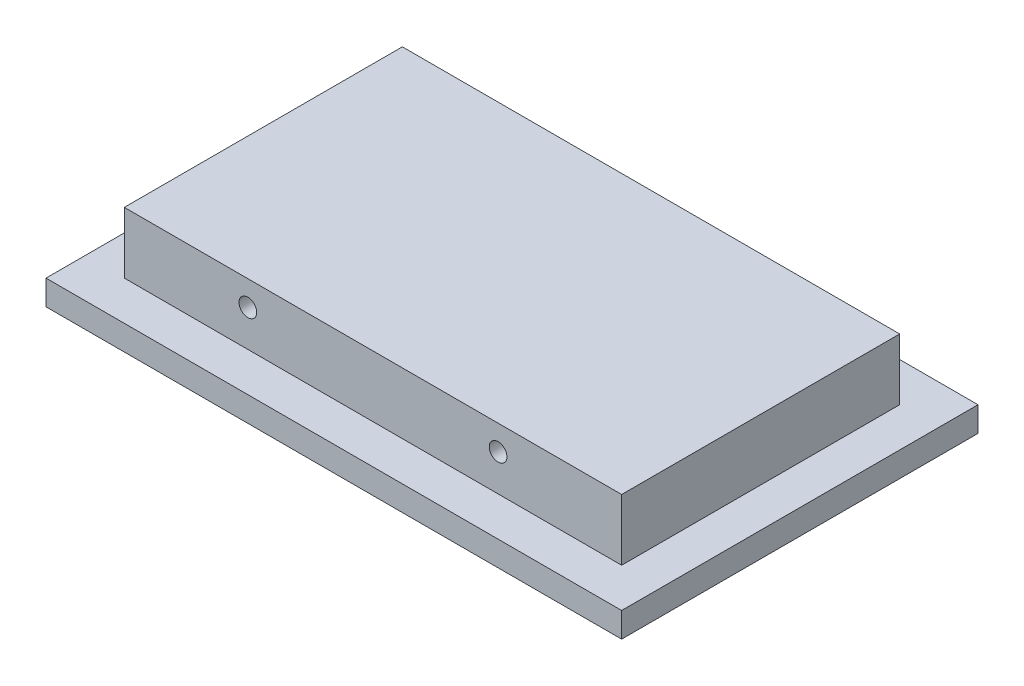
from build123d import *

# Parameters (mm, degrees)
MAIN_SKETCH_W                         = 73.5
MAIN_SKETCH_H                         = 45.5
MAIN_SKETCH_W_2                       = 63.5
MAIN_SKETCH_H_2                       = 35.5
LIP_DEPTH                             = 3.175
MOUNTING_BASE_OUTLINE_W               = 63.5
MOUNTING_BASE_OUTLINE_H               = 35.5
MOUNTING_BASE_DEPTH                   = 11
HEATER_CART_4_40_TAPS_D               = 2.2606
HEATER_CART_4_40_TAPS_DEPTH           = 7.595
HEATER_CART_4_40_TAPS_TIP             = 0.679152758
HEATER_CART_4_40_TAPS_ON_FACE_2_D     = 2.2606
HEATER_CART_4_40_TAPS_ON_FACE_2_DEPTH = 7.595
HEATER_CART_4_40_TAPS_ON_FACE_2_TIP   = 0.679152758


# Read off the part's stored shape, not the designer's step: Mounting_Base
with BuildPart() as part:
    # Main_Sketch → Lip (new body)
    with BuildSketch(Plane(origin=(0, 0, 0), x_dir=(1, 0, 0), z_dir=(0, 1, 0))):
        with Locations((36.75, -22.75)):
            Rectangle(MAIN_SKETCH_W, MAIN_SKETCH_H)
        with Locations((36.75, -22.75)):
            Rectangle(MAIN_SKETCH_W_2, MAIN_SKETCH_H_2, mode=Mode.SUBTRACT)
    extrude(amount=LIP_DEPTH)

    # Mounting_Base outline → Mounting_Base (add)
    with BuildSketch(Plane(origin=(0, 0, 0), x_dir=(1, 0, 0), z_dir=(0, 1, 0))):
        with Locations((36.75, -22.75)):
            Rectangle(MOUNTING_BASE_OUTLINE_W, MOUNTING_BASE_OUTLINE_H)
    extrude(amount=MOUNTING_BASE_DEPTH)

    # Heater_Cart_#4-40_Taps
    with Locations(Plane(origin=(52.725, 7.825, 5), x_dir=(-1, 0, 0), z_dir=(0, 0, -1))):
        with Locations((0, 0), (31.95, 0)):
            Hole(HEATER_CART_4_40_TAPS_D / 2, depth=HEATER_CART_4_40_TAPS_DEPTH)
            with Locations((0, 0, -(HEATER_CART_4_40_TAPS_DEPTH + HEATER_CART_4_40_TAPS_TIP / 2))):  # 118° drill point
                Cone(0, HEATER_CART_4_40_TAPS_D / 2, HEATER_CART_4_40_TAPS_TIP, mode=Mode.SUBTRACT)

    # Heater_Cart_#4-40_Taps on face 2
    with Locations(Plane(origin=(20.775, 7.825, 40.5), x_dir=(1, 0, 0), z_dir=(0, 0, 1))):
        with Locations((0, 0), (31.95, 0)):
            Hole(HEATER_CART_4_40_TAPS_ON_FACE_2_D / 2, depth=HEATER_CART_4_40_TAPS_ON_FACE_2_DEPTH)
            with Locations((0, 0, -(HEATER_CART_4_40_TAPS_ON_FACE_2_DEPTH + HEATER_CART_4_40_TAPS_ON_FACE_2_TIP / 2))):  # 118° drill point
                Cone(0, HEATER_CART_4_40_TAPS_ON_FACE_2_D / 2, HEATER_CART_4_40_TAPS_ON_FACE_2_TIP, mode=Mode.SUBTRACT)


solid = part.part
